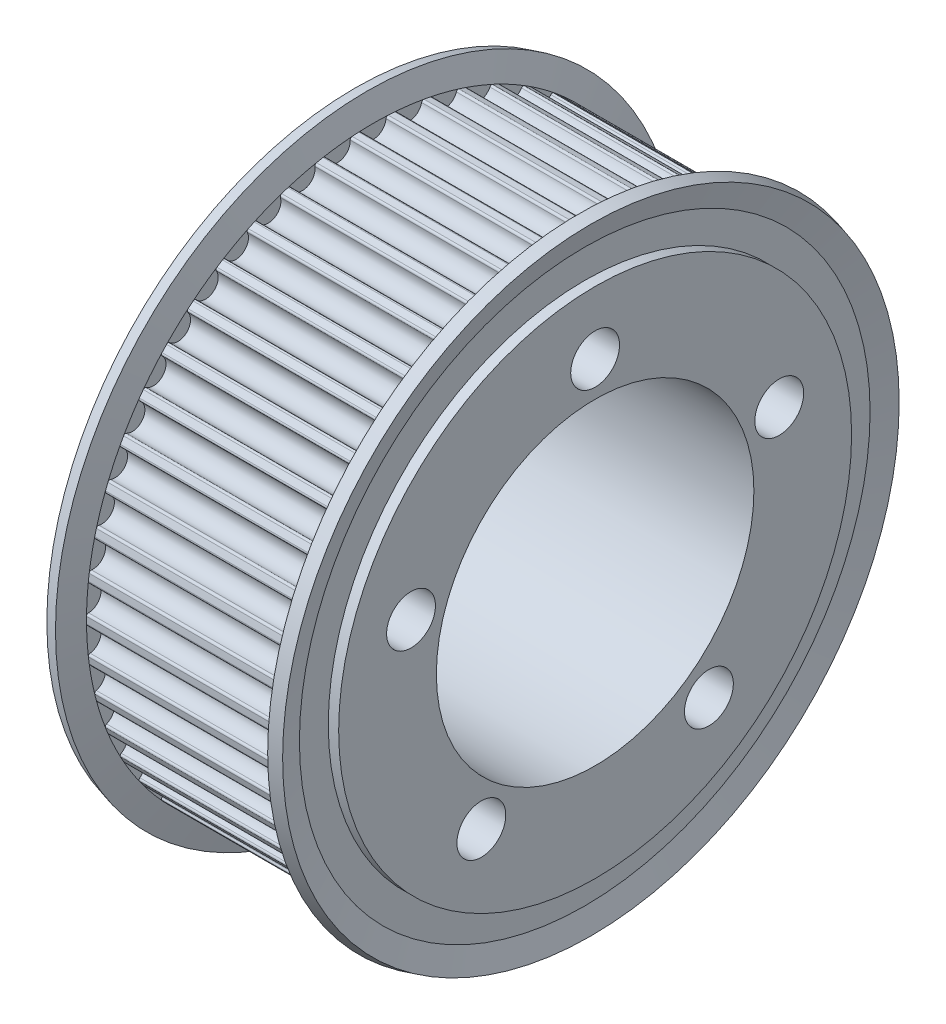
from build123d import *

# Parameters (mm, degrees)
CUT_EXTRUDE1_DEPTH       = 8.15
CUT_EXTRUDE1_DEPTH_BACK  = 8.15
CUT_EXTRUDE2_DEPTH       = 8.15
CUT_EXTRUDE2_DEPTH_BACK  = 8.15
CUT_EXTRUDE3_DEPTH       = 8.15
CUT_EXTRUDE3_DEPTH_BACK  = 8.15
CUT_EXTRUDE4_DEPTH       = 8.15
CUT_EXTRUDE4_DEPTH_BACK  = 8.15
CUT_EXTRUDE5_DEPTH       = 8.15
CUT_EXTRUDE5_DEPTH_BACK  = 8.15
CUT_EXTRUDE6_DEPTH       = 8.15
CUT_EXTRUDE6_DEPTH_BACK  = 8.15
CUT_EXTRUDE7_DEPTH       = 8.15
CUT_EXTRUDE7_DEPTH_BACK  = 8.15
CUT_EXTRUDE8_DEPTH       = 8.15
CUT_EXTRUDE8_DEPTH_BACK  = 8.15
CUT_EXTRUDE9_DEPTH       = 8.15
CUT_EXTRUDE9_DEPTH_BACK  = 8.15
CUT_EXTRUDE10_DEPTH      = 8.15
CUT_EXTRUDE10_DEPTH_BACK = 8.15
CUT_EXTRUDE11_DEPTH      = 8.15
CUT_EXTRUDE11_DEPTH_BACK = 8.15
CUT_EXTRUDE12_DEPTH      = 8.15
CUT_EXTRUDE12_DEPTH_BACK = 8.15
CUT_EXTRUDE13_DEPTH      = 8.15
CUT_EXTRUDE13_DEPTH_BACK = 8.15
CUT_EXTRUDE14_DEPTH      = 8.15
CUT_EXTRUDE14_DEPTH_BACK = 8.15
CUT_EXTRUDE15_DEPTH      = 8.15
CUT_EXTRUDE15_DEPTH_BACK = 8.15
CUT_EXTRUDE16_DEPTH      = 8.15
CUT_EXTRUDE16_DEPTH_BACK = 8.15
CUT_EXTRUDE17_DEPTH      = 8.15
CUT_EXTRUDE17_DEPTH_BACK = 8.15
CUT_EXTRUDE18_DEPTH      = 8.15
CUT_EXTRUDE18_DEPTH_BACK = 8.15
CUT_EXTRUDE19_DEPTH      = 8.15
CUT_EXTRUDE19_DEPTH_BACK = 8.15
CUT_EXTRUDE20_DEPTH      = 8.15
CUT_EXTRUDE20_DEPTH_BACK = 8.15
CUT_EXTRUDE21_DEPTH      = 8.15
CUT_EXTRUDE21_DEPTH_BACK = 8.15
CUT_EXTRUDE22_DEPTH      = 8.15
CUT_EXTRUDE22_DEPTH_BACK = 8.15
CUT_EXTRUDE23_DEPTH      = 8.15
CUT_EXTRUDE23_DEPTH_BACK = 8.15
CUT_EXTRUDE24_DEPTH      = 8.15
CUT_EXTRUDE24_DEPTH_BACK = 8.15
CUT_EXTRUDE25_DEPTH      = 8.15
CUT_EXTRUDE25_DEPTH_BACK = 8.15
CUT_EXTRUDE26_DEPTH      = 8.15
CUT_EXTRUDE26_DEPTH_BACK = 8.15
CUT_EXTRUDE27_DEPTH      = 8.15
CUT_EXTRUDE27_DEPTH_BACK = 8.15
CUT_EXTRUDE28_DEPTH      = 8.15
CUT_EXTRUDE28_DEPTH_BACK = 8.15
CUT_EXTRUDE29_DEPTH      = 8.15
CUT_EXTRUDE29_DEPTH_BACK = 8.15
CUT_EXTRUDE30_DEPTH      = 8.15
CUT_EXTRUDE30_DEPTH_BACK = 8.15
CUT_EXTRUDE31_DEPTH      = 8.15
CUT_EXTRUDE31_DEPTH_BACK = 8.15
CUT_EXTRUDE32_DEPTH      = 8.15
CUT_EXTRUDE32_DEPTH_BACK = 8.15
CUT_EXTRUDE33_DEPTH      = 8.15
CUT_EXTRUDE33_DEPTH_BACK = 8.15
CUT_EXTRUDE34_DEPTH      = 8.15
CUT_EXTRUDE34_DEPTH_BACK = 8.15
CUT_EXTRUDE35_DEPTH      = 8.15
CUT_EXTRUDE35_DEPTH_BACK = 8.15
CUT_EXTRUDE36_DEPTH      = 8.15
CUT_EXTRUDE36_DEPTH_BACK = 8.15
CUT_EXTRUDE37_DEPTH      = 8.15
CUT_EXTRUDE37_DEPTH_BACK = 8.15
CUT_EXTRUDE38_DEPTH      = 8.15
CUT_EXTRUDE38_DEPTH_BACK = 8.15
CUT_EXTRUDE39_DEPTH      = 8.15
CUT_EXTRUDE39_DEPTH_BACK = 8.15
CUT_EXTRUDE40_DEPTH      = 8.15
CUT_EXTRUDE40_DEPTH_BACK = 8.15
CUT_EXTRUDE41_DEPTH      = 8.15
CUT_EXTRUDE41_DEPTH_BACK = 8.15
CUT_EXTRUDE42_DEPTH      = 8.15
CUT_EXTRUDE42_DEPTH_BACK = 8.15
CUT_EXTRUDE43_DEPTH      = 8.15
CUT_EXTRUDE43_DEPTH_BACK = 8.15
CUT_EXTRUDE44_DEPTH      = 8.15
CUT_EXTRUDE44_DEPTH_BACK = 8.15
CUT_EXTRUDE45_DEPTH      = 8.15
CUT_EXTRUDE45_DEPTH_BACK = 8.15
CUT_EXTRUDE46_DEPTH      = 8.15
CUT_EXTRUDE46_DEPTH_BACK = 8.15
CUT_EXTRUDE47_DEPTH      = 8.15
CUT_EXTRUDE47_DEPTH_BACK = 8.15
CUT_EXTRUDE48_DEPTH      = 8.15
CUT_EXTRUDE48_DEPTH_BACK = 8.15
CUT_EXTRUDE49_DEPTH      = 8.15
CUT_EXTRUDE49_DEPTH_BACK = 8.15
CUT_EXTRUDE50_DEPTH      = 8.15
CUT_EXTRUDE50_DEPTH_BACK = 8.15
SKETCH52_W               = 20
SKETCH52_H               = 13
SKETCH53_R               = 2
CUT_EXTRUDE51_DEPTH      = 42.237119201


with BuildPart() as part:
    # Sketch1 → Revolve1 (revolve)
    with BuildSketch(Plane.XY):
        Polygon((0, 0), (0, 21), (0.85, 21), (0.85, 23.363347502), (0.346836043, 25.241180955), (1.312761869, 25.5), (1.85, 23.495), (18.15, 23.495), (18.687238131, 25.5), (19.653163957, 25.241180955), (19.15, 23.363347502), (19.15, 21), (20, 21), (20, 0), align=None)
    revolve(axis=Axis((20, 0, 0), (-1, 0, 0)))

    # Sketch2 → Cut-Extrude1 (cut, two sides: drawn at the far end of the back side and taken through both)
    with BuildSketch(Plane(origin=(10, 0, 0), x_dir=(0, 0, -1), z_dir=(1, 0, 0)).offset(-CUT_EXTRUDE1_DEPTH_BACK)):
        with BuildLine():
            Line((-1.224781335, 23.843563821), (-1.205287433, 23.464064166))
            ThreePointArc((-1.205287433, 23.464064166), (-1.084227929, 23.421881307), (-1.027052897, 23.307138931))
            ThreePointArc((-1.027052897, 23.307138931), (-6.2e-08, 22.355), (1.027052888, 23.307138808))
            ThreePointArc((1.027052888, 23.307138808), (1.084227883, 23.421881266), (1.205287433, 23.464064166))
            Line((1.205287433, 23.464064166), (1.224781335, 23.843563821))
            ThreePointArc((1.224781335, 23.843563821), (0, 23.875), (-1.224781335, 23.843563821))
        make_face()
    extrude(amount=CUT_EXTRUDE1_DEPTH + CUT_EXTRUDE1_DEPTH_BACK, mode=Mode.SUBTRACT)

    # Sketch3 → Cut-Extrude2 (cut, two sides: drawn at the far end of the back side and taken through both)
    with BuildSketch(Plane(origin=(10, 0, 0), x_dir=(0, 0, -1), z_dir=(1, 0, 0)).offset(-CUT_EXTRUDE2_DEPTH_BACK)):
        with BuildLine():
            Line((-4.203514522, 23.502044393), (-4.136610416, 23.127980441))
            ThreePointArc((-4.136610416, 23.127980441), (-4.011218589, 23.101302985), (-3.940113366, 22.994631319))
            ThreePointArc((-3.940113366, 22.994631319), (-2.801824498, 22.17872414), (-1.902204803, 23.252078917))
            ThreePointArc((-1.902204803, 23.252078917), (-1.859861693, 23.373082523), (-1.745043653, 23.430105583))
            Line((-1.745043653, 23.430105583), (-1.773267385, 23.809056004))
            ThreePointArc((-1.773267385, 23.809056004), (-2.992330951, 23.686738494), (-4.203514522, 23.502044393))
        make_face()
    extrude(amount=CUT_EXTRUDE2_DEPTH + CUT_EXTRUDE2_DEPTH_BACK, mode=Mode.SUBTRACT)

    # Sketch4 → Cut-Extrude3 (cut, two sides: drawn at the far end of the back side and taken through both)
    with BuildSketch(Plane(origin=(10, 0, 0), x_dir=(0, 0, -1), z_dir=(1, 0, 0)).offset(-CUT_EXTRUDE3_DEPTH_BACK)):
        with BuildLine():
            Line((-7.115955773, 22.789883686), (-7.002696582, 22.427154647))
            ThreePointArc((-7.002696582, 22.427154647), (-6.874949935, 22.416403315), (-6.791035893, 22.319484634))
            ThreePointArc((-6.791035893, 22.319484634), (-5.559462488, 21.652676552), (-4.801463587, 22.83031985))
            ThreePointArc((-4.801463587, 22.83031985), (-4.774620139, 22.955676306), (-4.667854358, 23.026640239))
            Line((-4.667854358, 23.026640239), (-4.743350619, 23.39906515))
            ThreePointArc((-4.743350619, 23.39906515), (-5.937471056, 23.124922972), (-7.115955773, 22.789883686))
        make_face()
    extrude(amount=CUT_EXTRUDE3_DEPTH + CUT_EXTRUDE3_DEPTH_BACK, mode=Mode.SUBTRACT)

    # Sketch5 → Cut-Extrude4 (cut, two sides: drawn at the far end of the back side and taken through both)
    with BuildSketch(Plane(origin=(10, 0, 0), x_dir=(0, 0, -1), z_dir=(1, 0, 0)).offset(-CUT_EXTRUDE4_DEPTH_BACK)):
        with BuildLine():
            Line((-9.916174152, 21.718312899), (-9.758346039, 21.372639228))
            ThreePointArc((-9.758346039, 21.372639228), (-9.630259213, 21.377983573), (-9.534859727, 21.292346343))
            ThreePointArc((-9.534859727, 21.292346343), (-8.229424433, 20.785153319), (-7.625000423, 22.048513002))
            ThreePointArc((-7.625000423, 22.048513002), (-7.614079973, 22.176245361), (-7.517050211, 22.260031022))
            Line((-7.517050211, 22.260031022), (-7.63862838, 22.620057062))
            ThreePointArc((-7.63862838, 22.620057062), (-8.788973695, 22.198413601), (-9.916174152, 21.718312899))
        make_face()
    extrude(amount=CUT_EXTRUDE4_DEPTH + CUT_EXTRUDE4_DEPTH_BACK, mode=Mode.SUBTRACT)

    # Sketch6 → Cut-Extrude5 (cut, two sides: drawn at the far end of the back side and taken through both)
    with BuildSketch(Plane(origin=(10, 0, 0), x_dir=(0, 0, -1), z_dir=(1, 0, 0)).offset(-CUT_EXTRUDE5_DEPTH_BACK)):
        with BuildLine():
            Line((-12.56000854, 20.304231344), (-12.360100551, 19.981064521))
            ThreePointArc((-12.360100551, 19.981064521), (-12.233693551, 20.00242026), (-12.128313128, 19.929415032))
            ThreePointArc((-12.128313128, 19.929415032), (-10.769603439, 19.589835803), (-10.328286447, 20.918987932))
            ThreePointArc((-10.328286447, 20.918987932), (-10.333461218, 21.047081779), (-10.247697692, 21.142367819))
            Line((-10.247697692, 21.142367819), (-10.413440409, 21.48431716))
            ThreePointArc((-10.413440409, 21.48431716), (-11.501868969, 20.921821986), (-12.56000854, 20.304231344))
        make_face()
    extrude(amount=CUT_EXTRUDE5_DEPTH + CUT_EXTRUDE5_DEPTH_BACK, mode=Mode.SUBTRACT)

    # Sketch7 → Cut-Extrude6 (cut, two sides: drawn at the far end of the back side and taken through both)
    with BuildSketch(Plane(origin=(10, 0, 0), x_dir=(0, 0, -1), z_dir=(1, 0, 0)).offset(-CUT_EXTRUDE6_DEPTH_BACK)):
        with BuildLine():
            Line((-15.00576409, 18.569939932), (-14.766928892, 18.27437649))
            ThreePointArc((-14.766928892, 18.27437649), (-14.644195234, 18.311406831), (-14.530495785, 18.252184939))
            ThreePointArc((-14.530495785, 18.252184939), (-13.139939365, 18.085574873), (-12.868689224, 19.459557927))
            ThreePointArc((-12.868689224, 19.459557927), (-12.889877606, 19.585993144), (-12.816732859, 19.691276846))
            Line((-12.816732859, 19.691276846), (-13.024026262, 20.009756744))
            ThreePointArc((-13.024026262, 20.009756744), (-14.033372898, 19.315280741), (-15.00576409, 18.569939932))
        make_face()
    extrude(amount=CUT_EXTRUDE6_DEPTH + CUT_EXTRUDE6_DEPTH_BACK, mode=Mode.SUBTRACT)

    # Sketch8 → Cut-Extrude7 (cut, two sides: drawn at the far end of the back side and taken through both)
    with BuildSketch(Plane(origin=(10, 0, 0), x_dir=(0, 0, -1), z_dir=(1, 0, 0)).offset(-CUT_EXTRUDE7_DEPTH_BACK)):
        with BuildLine():
            Line((-17.214869777, 16.542789473), (-16.940873944, 16.279490625))
            ThreePointArc((-16.940873944, 16.279490625), (-16.82374921, 16.331611577), (-16.703523844, 16.287106987))
            ThreePointArc((-16.703523844, 16.287106987), (-15.303050598, 16.296093624), (-15.206145084, 17.693239068))
            ThreePointArc((-15.206145084, 17.693239068), (-15.243012925, 17.816021698), (-15.183640493, 17.929642673))
            Line((-15.183640493, 17.929642673), (-15.42921544, 18.21963051))
            ThreePointArc((-15.42921544, 18.21963051), (-16.343562154, 17.40412598), (-17.214869777, 16.542789473))
        make_face()
    extrude(amount=CUT_EXTRUDE7_DEPTH + CUT_EXTRUDE7_DEPTH_BACK, mode=Mode.SUBTRACT)

    # Sketch9 → Cut-Extrude8 (cut, two sides: drawn at the far end of the back side and taken through both)
    with BuildSketch(Plane(origin=(10, 0, 0), x_dir=(0, 0, -1), z_dir=(1, 0, 0)).offset(-CUT_EXTRUDE8_DEPTH_BACK)):
        with BuildLine():
            Line((-19.152486684, 14.254749342), (-18.847651294, 14.027867468))
            ThreePointArc((-18.847651294, 14.027867468), (-18.73798261, 14.094257052), (-18.613127353, 14.065171629))
            ThreePointArc((-18.613127353, 14.065171629), (-17.224823582, 14.249613243), (-17.303790953, 15.64788726))
            ThreePointArc((-17.303790953, 15.64788726), (-17.355756823, 15.765080946), (-17.311093045, 15.885247325))
            Line((-17.311093045, 15.885247325), (-17.591076674, 16.142169819))
            ThreePointArc((-17.591076674, 16.142169819), (-18.396003671, 15.218497755), (-19.152486684, 14.254749342))
        make_face()
    extrude(amount=CUT_EXTRUDE8_DEPTH + CUT_EXTRUDE8_DEPTH_BACK, mode=Mode.SUBTRACT)

    # Sketch10 → Cut-Extrude9 (cut, two sides: drawn at the far end of the back side and taken through both)
    with BuildSketch(Plane(origin=(10, 0, 0), x_dir=(0, 0, -1), z_dir=(1, 0, 0)).offset(-CUT_EXTRUDE9_DEPTH_BACK)):
        with BuildLine():
            Line((-20.788057435, 11.741903299), (-20.457189924, 11.555016461))
            ThreePointArc((-20.457189924, 11.555016461), (-20.356706832, 11.634627675), (-20.229190726, 11.621420112))
            ThreePointArc((-20.229190726, 11.621420112), (-18.874950808, 11.97840795), (-19.128545702, 13.355758922))
            ThreePointArc((-19.128545702, 13.355758922), (-19.194790069, 13.46551545), (-19.165539319, 13.590332138))
            Line((-19.165539319, 13.590332138), (-19.47551612, 13.810137467))
            ThreePointArc((-19.47551612, 13.810137467), (-20.158329221, 12.79286473), (-20.788057435, 11.741903299))
        make_face()
    extrude(amount=CUT_EXTRUDE9_DEPTH + CUT_EXTRUDE9_DEPTH_BACK, mode=Mode.SUBTRACT)

    # Sketch11 → Cut-Extrude10 (cut, two sides: drawn at the far end of the back side and taken through both)
    with BuildSketch(Plane(origin=(10, 0, 0), x_dir=(0, 0, -1), z_dir=(1, 0, 0)).offset(-CUT_EXTRUDE10_DEPTH_BACK)):
        with BuildLine():
            Line((-22.095788102, 9.043880427), (-21.744106448, 8.899935942))
            ThreePointArc((-21.744106448, 8.899935942), (-21.654393626, 8.991513269), (-21.526227676, 8.994391857))
            ThreePointArc((-21.526227676, 8.994391857), (-20.227408784, 9.518296007), (-20.651631858, 10.853002287))
            ThreePointArc((-20.651631858, 10.853002287), (-20.731110009, 10.953590732), (-20.717733589, 11.081089294))
            Line((-20.717733589, 11.081089294), (-21.052815043, 11.260310997))
            ThreePointArc((-21.052815043, 11.260310997), (-21.602745878, 10.165480586), (-22.095788102, 9.043880427))
        make_face()
    extrude(amount=CUT_EXTRUDE10_DEPTH + CUT_EXTRUDE10_DEPTH_BACK, mode=Mode.SUBTRACT)

    # Sketch12 → Cut-Extrude11 (cut, two sides: drawn at the far end of the back side and taken through both)
    with BuildSketch(Plane(origin=(10, 0, 0), x_dir=(0, 0, -1), z_dir=(1, 0, 0)).offset(-CUT_EXTRUDE11_DEPTH_BACK)):
        with BuildLine():
            Line((-23.05505499, 6.203230157), (-22.688105424, 6.104498117))
            ThreePointArc((-22.688105424, 6.104498117), (-22.610577697, 6.206597327), (-22.483783156, 6.225516669))
            ThreePointArc((-22.483783156, 6.225516669), (-21.260868441, 6.90807485), (-21.849029443, 8.179087324))
            ThreePointArc((-21.849029443, 8.179087324), (-21.940487961, 8.268921345), (-21.943196824, 8.397091052))
            Line((-21.943196824, 8.397091052), (-22.298098497, 8.532902697))
            ThreePointArc((-22.298098497, 8.532902697), (-22.706474327, 7.377780741), (-23.05505499, 6.203230157))
        make_face()
    extrude(amount=CUT_EXTRUDE11_DEPTH + CUT_EXTRUDE11_DEPTH_BACK, mode=Mode.SUBTRACT)

    # Sketch13 → Cut-Extrude12 (cut, two sides: drawn at the far end of the back side and taken through both)
    with BuildSketch(Plane(origin=(10, 0, 0), x_dir=(0, 0, -1), z_dir=(1, 0, 0)).offset(-CUT_EXTRUDE12_DEPTH_BACK)):
        with BuildLine():
            Line((-23.65072989, 3.264751243), (-23.274299425, 3.21278871))
            ThreePointArc((-23.274299425, 3.21278871), (-23.210179451, 3.323799637), (-23.086755945, 3.358461365))
            ThreePointArc((-23.086755945, 3.358461365), (-21.959031502, 4.188909227), (-22.701854782, 5.376183267))
            ThreePointArc((-22.701854782, 5.376183267), (-22.80385131, 5.453846128), (-22.822602737, 5.580665668))
            Line((-22.822602737, 5.580665668), (-23.191727617, 5.670925423))
            ThreePointArc((-23.191727617, 5.670925423), (-23.452108111, 4.473728886), (-23.65072989, 3.264751243))
        make_face()
    extrude(amount=CUT_EXTRUDE12_DEPTH + CUT_EXTRUDE12_DEPTH_BACK, mode=Mode.SUBTRACT)

    # Sketch14 → Cut-Extrude13 (cut, two sides: drawn at the far end of the back side and taken through both)
    with BuildSketch(Plane(origin=(10, 0, 0), x_dir=(0, 0, -1), z_dir=(1, 0, 0)).offset(-CUT_EXTRUDE13_DEPTH_BACK)):
        with BuildLine():
            Line((-23.873418651, 0.274785251), (-23.49344382, 0.270411706))
            ThreePointArc((-23.49344382, 0.270411706), (-23.44374281, 0.388583642), (-23.325636802, 0.438441119))
            ThreePointArc((-23.325636802, 0.438441119), (-22.310887518, 1.403682002), (-23.196658309, 2.488493588))
            ThreePointArc((-23.196658309, 2.488493588), (-23.307584302, 2.5527605), (-23.342082571, 2.676229853))
            Line((-23.342082571, 2.676229853), (-23.719609338, 2.719514269))
            ThreePointArc((-23.719609338, 2.719514269), (-23.827888141, 1.499123654), (-23.873418651, 0.274785251))
        make_face()
    extrude(amount=CUT_EXTRUDE13_DEPTH + CUT_EXTRUDE13_DEPTH_BACK, mode=Mode.SUBTRACT)

    # Sketch15 → Cut-Extrude14 (cut, two sides: drawn at the far end of the back side and taken through both)
    with BuildSketch(Plane(origin=(10, 0, 0), x_dir=(0, 0, -1), z_dir=(1, 0, 0)).offset(-CUT_EXTRUDE14_DEPTH_BACK)):
        with BuildLine():
            Line((-23.719609338, -2.719514269), (-23.342082571, -2.676229853))
            ThreePointArc((-23.342082571, -2.676229853), (-23.30758434, -2.552760549), (-23.196658432, -2.488493605))
            ThreePointArc((-23.196658432, -2.488493605), (-22.31088751, -1.403682126), (-23.325636678, -0.438441121))
            ThreePointArc((-23.325636678, -0.438441121), (-23.443742766, -0.388583686), (-23.49344382, -0.270411706))
            Line((-23.49344382, -0.270411706), (-23.873418651, -0.274785251))
            ThreePointArc((-23.873418651, -0.274785251), (-23.827888141, -1.499123654), (-23.719609338, -2.719514269))
        make_face()
    extrude(amount=CUT_EXTRUDE14_DEPTH + CUT_EXTRUDE14_DEPTH_BACK, mode=Mode.SUBTRACT)

    # Sketch16 → Cut-Extrude15 (cut, two sides: drawn at the far end of the back side and taken through both)
    with BuildSketch(Plane(origin=(10, 0, 0), x_dir=(0, 0, -1), z_dir=(1, 0, 0)).offset(-CUT_EXTRUDE15_DEPTH_BACK)):
        with BuildLine():
            Line((-23.191727617, -5.670925423), (-22.822602737, -5.580665668))
            ThreePointArc((-22.822602737, -5.580665668), (-22.803851341, -5.453846181), (-22.701854901, -5.376183299))
            ThreePointArc((-22.701854901, -5.376183299), (-21.959031478, -4.188909348), (-23.086755822, -3.358461351))
            ThreePointArc((-23.086755822, -3.358461351), (-23.210179402, -3.323799675), (-23.274299425, -3.21278871))
            Line((-23.274299425, -3.21278871), (-23.65072989, -3.264751243))
            ThreePointArc((-23.65072989, -3.264751243), (-23.452108111, -4.473728886), (-23.191727617, -5.670925423))
        make_face()
    extrude(amount=CUT_EXTRUDE15_DEPTH + CUT_EXTRUDE15_DEPTH_BACK, mode=Mode.SUBTRACT)

    # Sketch17 → Cut-Extrude16 (cut, two sides: drawn at the far end of the back side and taken through both)
    with BuildSketch(Plane(origin=(10, 0, 0), x_dir=(0, 0, -1), z_dir=(1, 0, 0)).offset(-CUT_EXTRUDE16_DEPTH_BACK)):
        with BuildLine():
            Line((-22.298098497, -8.532902697), (-21.943196824, -8.397091052))
            ThreePointArc((-21.943196824, -8.397091052), (-21.940487985, -8.268921402), (-21.849029558, -8.179087371))
            ThreePointArc((-21.849029558, -8.179087371), (-21.260868403, -6.908074968), (-22.483783036, -6.22551664))
            ThreePointArc((-22.483783036, -6.22551664), (-22.610577644, -6.206597358), (-22.688105424, -6.104498117))
            Line((-22.688105424, -6.104498117), (-23.05505499, -6.203230157))
            ThreePointArc((-23.05505499, -6.203230157), (-22.706474327, -7.377780741), (-22.298098497, -8.532902697))
        make_face()
    extrude(amount=CUT_EXTRUDE16_DEPTH + CUT_EXTRUDE16_DEPTH_BACK, mode=Mode.SUBTRACT)

    # Sketch18 → Cut-Extrude17 (cut, two sides: drawn at the far end of the back side and taken through both)
    with BuildSketch(Plane(origin=(10, 0, 0), x_dir=(0, 0, -1), z_dir=(1, 0, 0)).offset(-CUT_EXTRUDE17_DEPTH_BACK)):
        with BuildLine():
            Line((-21.052815043, -11.260310997), (-20.717733589, -11.081089294))
            ThreePointArc((-20.717733589, -11.081089294), (-20.731110027, -10.953590792), (-20.651631966, -10.853002348))
            ThreePointArc((-20.651631966, -10.853002348), (-20.227408732, -9.518296119), (-21.52622756, -8.994391813))
            ThreePointArc((-21.52622756, -8.994391813), (-21.654393569, -8.991513293), (-21.744106448, -8.899935942))
            Line((-21.744106448, -8.899935942), (-22.095788102, -9.043880427))
            ThreePointArc((-22.095788102, -9.043880427), (-21.602745878, -10.165480586), (-21.052815043, -11.260310997))
        make_face()
    extrude(amount=CUT_EXTRUDE17_DEPTH + CUT_EXTRUDE17_DEPTH_BACK, mode=Mode.SUBTRACT)

    # Sketch19 → Cut-Extrude18 (cut, two sides: drawn at the far end of the back side and taken through both)
    with BuildSketch(Plane(origin=(10, 0, 0), x_dir=(0, 0, -1), z_dir=(1, 0, 0)).offset(-CUT_EXTRUDE18_DEPTH_BACK)):
        with BuildLine():
            Line((-19.47551612, -13.810137467), (-19.165539319, -13.590332138))
            ThreePointArc((-19.165539319, -13.590332138), (-19.194790079, -13.465515512), (-19.128545801, -13.355758996))
            ThreePointArc((-19.128545801, -13.355758996), (-18.874950741, -11.978408054), (-20.229190616, -11.621420053))
            ThreePointArc((-20.229190616, -11.621420053), (-20.356706772, -11.634627692), (-20.457189924, -11.555016461))
            Line((-20.457189924, -11.555016461), (-20.788057435, -11.741903299))
            ThreePointArc((-20.788057435, -11.741903299), (-20.158329221, -12.79286473), (-19.47551612, -13.810137467))
        make_face()
    extrude(amount=CUT_EXTRUDE18_DEPTH + CUT_EXTRUDE18_DEPTH_BACK, mode=Mode.SUBTRACT)

    # Sketch20 → Cut-Extrude19 (cut, two sides: drawn at the far end of the back side and taken through both)
    with BuildSketch(Plane(origin=(10, 0, 0), x_dir=(0, 0, -1), z_dir=(1, 0, 0)).offset(-CUT_EXTRUDE19_DEPTH_BACK)):
        with BuildLine():
            Line((-17.591076674, -16.142169819), (-17.311093045, -15.885247325))
            ThreePointArc((-17.311093045, -15.885247325), (-17.355756825, -15.765081008), (-17.303791042, -15.647887346))
            ThreePointArc((-17.303791042, -15.647887346), (-17.224823503, -14.249613339), (-18.613127252, -14.065171557))
            ThreePointArc((-18.613127252, -14.065171557), (-18.737982549, -14.094257062), (-18.847651294, -14.027867468))
            Line((-18.847651294, -14.027867468), (-19.152486684, -14.254749342))
            ThreePointArc((-19.152486684, -14.254749342), (-18.396003671, -15.218497755), (-17.591076674, -16.142169819))
        make_face()
    extrude(amount=CUT_EXTRUDE19_DEPTH + CUT_EXTRUDE19_DEPTH_BACK, mode=Mode.SUBTRACT)

    # Sketch21 → Cut-Extrude20 (cut, two sides: drawn at the far end of the back side and taken through both)
    with BuildSketch(Plane(origin=(10, 0, 0), x_dir=(0, 0, -1), z_dir=(1, 0, 0)).offset(-CUT_EXTRUDE20_DEPTH_BACK)):
        with BuildLine():
            Line((-15.42921544, -18.21963051), (-15.183640493, -17.929642673))
            ThreePointArc((-15.183640493, -17.929642673), (-15.243012919, -17.816021759), (-15.206145162, -17.693239164))
            ThreePointArc((-15.206145162, -17.693239164), (-15.303050508, -16.296093708), (-16.703523753, -16.287106904))
            ThreePointArc((-16.703523753, -16.287106904), (-16.823749148, -16.331611579), (-16.940873944, -16.279490625))
            Line((-16.940873944, -16.279490625), (-17.214869777, -16.542789473))
            ThreePointArc((-17.214869777, -16.542789473), (-16.343562154, -17.40412598), (-15.42921544, -18.21963051))
        make_face()
    extrude(amount=CUT_EXTRUDE20_DEPTH + CUT_EXTRUDE20_DEPTH_BACK, mode=Mode.SUBTRACT)

    # Sketch22 → Cut-Extrude21 (cut, two sides: drawn at the far end of the back side and taken through both)
    with BuildSketch(Plane(origin=(10, 0, 0), x_dir=(0, 0, -1), z_dir=(1, 0, 0)).offset(-CUT_EXTRUDE21_DEPTH_BACK)):
        with BuildLine():
            Line((-13.024026262, -20.009756744), (-12.816732859, -19.691276846))
            ThreePointArc((-12.816732859, -19.691276846), (-12.889877593, -19.585993205), (-12.868689289, -19.459558032))
            ThreePointArc((-12.868689289, -19.459558032), (-13.139939265, -18.085574946), (-14.530495705, -18.252184845))
            ThreePointArc((-14.530495705, -18.252184845), (-14.644195172, -18.311406825), (-14.766928892, -18.27437649))
            Line((-14.766928892, -18.27437649), (-15.00576409, -18.569939932))
            ThreePointArc((-15.00576409, -18.569939932), (-14.033372898, -19.315280741), (-13.024026262, -20.009756744))
        make_face()
    extrude(amount=CUT_EXTRUDE21_DEPTH + CUT_EXTRUDE21_DEPTH_BACK, mode=Mode.SUBTRACT)

    # Sketch23 → Cut-Extrude22 (cut, two sides: drawn at the far end of the back side and taken through both)
    with BuildSketch(Plane(origin=(10, 0, 0), x_dir=(0, 0, -1), z_dir=(1, 0, 0)).offset(-CUT_EXTRUDE22_DEPTH_BACK)):
        with BuildLine():
            Line((-10.413440409, -21.48431716), (-10.247697692, -21.142367819))
            ThreePointArc((-10.247697692, -21.142367819), (-10.333461197, -21.047081837), (-10.328286498, -20.918988045))
            ThreePointArc((-10.328286498, -20.918988045), (-10.76960333, -19.589835862), (-12.12831306, -19.929414928))
            ThreePointArc((-12.12831306, -19.929414928), (-12.233693491, -20.002420247), (-12.360100551, -19.981064521))
            Line((-12.360100551, -19.981064521), (-12.56000854, -20.304231344))
            ThreePointArc((-12.56000854, -20.304231344), (-11.501868969, -20.921821986), (-10.413440409, -21.48431716))
        make_face()
    extrude(amount=CUT_EXTRUDE22_DEPTH + CUT_EXTRUDE22_DEPTH_BACK, mode=Mode.SUBTRACT)

    # Sketch24 → Cut-Extrude23 (cut, two sides: drawn at the far end of the back side and taken through both)
    with BuildSketch(Plane(origin=(10, 0, 0), x_dir=(0, 0, -1), z_dir=(1, 0, 0)).offset(-CUT_EXTRUDE23_DEPTH_BACK)):
        with BuildLine():
            Line((-7.63862838, -22.620057062), (-7.517050211, -22.260031022))
            ThreePointArc((-7.517050211, -22.260031022), (-7.614079945, -22.176245416), (-7.62500046, -22.04851312))
            ThreePointArc((-7.62500046, -22.04851312), (-8.229424318, -20.785153365), (-9.534859673, -21.292346232))
            ThreePointArc((-9.534859673, -21.292346232), (-9.630259155, -21.377983552), (-9.758346039, -21.372639228))
            Line((-9.758346039, -21.372639228), (-9.916174152, -21.718312899))
            ThreePointArc((-9.916174152, -21.718312899), (-8.788973695, -22.198413601), (-7.63862838, -22.620057062))
        make_face()
    extrude(amount=CUT_EXTRUDE23_DEPTH + CUT_EXTRUDE23_DEPTH_BACK, mode=Mode.SUBTRACT)

    # Sketch25 → Cut-Extrude24 (cut, two sides: drawn at the far end of the back side and taken through both)
    with BuildSketch(Plane(origin=(10, 0, 0), x_dir=(0, 0, -1), z_dir=(1, 0, 0)).offset(-CUT_EXTRUDE24_DEPTH_BACK)):
        with BuildLine():
            Line((-4.743350619, -23.39906515), (-4.667854358, -23.026640239))
            ThreePointArc((-4.667854358, -23.026640239), (-4.774620104, -22.955676357), (-4.801463609, -22.830319972))
            ThreePointArc((-4.801463609, -22.830319972), (-5.559462368, -21.652676582), (-6.791035853, -22.319484517))
            ThreePointArc((-6.791035853, -22.319484517), (-6.87494988, -22.416403287), (-7.002696582, -22.427154647))
            Line((-7.002696582, -22.427154647), (-7.115955773, -22.789883686))
            ThreePointArc((-7.115955773, -22.789883686), (-5.937471056, -23.124922972), (-4.743350619, -23.39906515))
        make_face()
    extrude(amount=CUT_EXTRUDE24_DEPTH + CUT_EXTRUDE24_DEPTH_BACK, mode=Mode.SUBTRACT)

    # Sketch26 → Cut-Extrude25 (cut, two sides: drawn at the far end of the back side and taken through both)
    with BuildSketch(Plane(origin=(10, 0, 0), x_dir=(0, 0, -1), z_dir=(1, 0, 0)).offset(-CUT_EXTRUDE25_DEPTH_BACK)):
        with BuildLine():
            Line((-1.773267385, -23.809056004), (-1.745043653, -23.430105583))
            ThreePointArc((-1.745043653, -23.430105583), (-1.859861652, -23.37308257), (-1.902204809, -23.25207904))
            ThreePointArc((-1.902204809, -23.25207904), (-2.801824375, -22.178724156), (-3.940113341, -22.994631198))
            ThreePointArc((-3.940113341, -22.994631198), (-4.011218538, -23.10130295), (-4.136610416, -23.127980441))
            Line((-4.136610416, -23.127980441), (-4.203514522, -23.502044393))
            ThreePointArc((-4.203514522, -23.502044393), (-2.992330951, -23.686738494), (-1.773267385, -23.809056004))
        make_face()
    extrude(amount=CUT_EXTRUDE25_DEPTH + CUT_EXTRUDE25_DEPTH_BACK, mode=Mode.SUBTRACT)

    # Sketch27 → Cut-Extrude26 (cut, two sides: drawn at the far end of the back side and taken through both)
    with BuildSketch(Plane(origin=(10, 0, 0), x_dir=(0, 0, -1), z_dir=(1, 0, 0)).offset(-CUT_EXTRUDE26_DEPTH_BACK)):
        with BuildLine():
            Line((1.224781335, -23.843563821), (1.205287433, -23.464064166))
            ThreePointArc((1.205287433, -23.464064166), (1.084227929, -23.421881307), (1.027052897, -23.307138931))
            ThreePointArc((1.027052897, -23.307138931), (6.2e-08, -22.355), (-1.027052888, -23.307138808))
            ThreePointArc((-1.027052888, -23.307138808), (-1.084227883, -23.421881266), (-1.205287433, -23.464064166))
            Line((-1.205287433, -23.464064166), (-1.224781335, -23.843563821))
            ThreePointArc((-1.224781335, -23.843563821), (0, -23.875), (1.224781335, -23.843563821))
        make_face()
    extrude(amount=CUT_EXTRUDE26_DEPTH + CUT_EXTRUDE26_DEPTH_BACK, mode=Mode.SUBTRACT)

    # Sketch28 → Cut-Extrude27 (cut, two sides: drawn at the far end of the back side and taken through both)
    with BuildSketch(Plane(origin=(10, 0, 0), x_dir=(0, 0, -1), z_dir=(1, 0, 0)).offset(-CUT_EXTRUDE27_DEPTH_BACK)):
        with BuildLine():
            Line((4.203514522, -23.502044393), (4.136610416, -23.127980441))
            ThreePointArc((4.136610416, -23.127980441), (4.011218589, -23.101302985), (3.940113366, -22.994631319))
            ThreePointArc((3.940113366, -22.994631319), (2.801824498, -22.17872414), (1.902204803, -23.252078917))
            ThreePointArc((1.902204803, -23.252078917), (1.859861693, -23.373082523), (1.745043653, -23.430105583))
            Line((1.745043653, -23.430105583), (1.773267385, -23.809056004))
            ThreePointArc((1.773267385, -23.809056004), (2.992330951, -23.686738494), (4.203514522, -23.502044393))
        make_face()
    extrude(amount=CUT_EXTRUDE27_DEPTH + CUT_EXTRUDE27_DEPTH_BACK, mode=Mode.SUBTRACT)

    # Sketch29 → Cut-Extrude28 (cut, two sides: drawn at the far end of the back side and taken through both)
    with BuildSketch(Plane(origin=(10, 0, 0), x_dir=(0, 0, -1), z_dir=(1, 0, 0)).offset(-CUT_EXTRUDE28_DEPTH_BACK)):
        with BuildLine():
            Line((7.115955773, -22.789883686), (7.002696582, -22.427154647))
            ThreePointArc((7.002696582, -22.427154647), (6.874949935, -22.416403315), (6.791035893, -22.319484634))
            ThreePointArc((6.791035893, -22.319484634), (5.559462488, -21.652676552), (4.801463587, -22.83031985))
            ThreePointArc((4.801463587, -22.83031985), (4.774620139, -22.955676306), (4.667854358, -23.026640239))
            Line((4.667854358, -23.026640239), (4.743350619, -23.39906515))
            ThreePointArc((4.743350619, -23.39906515), (5.937471056, -23.124922972), (7.115955773, -22.789883686))
        make_face()
    extrude(amount=CUT_EXTRUDE28_DEPTH + CUT_EXTRUDE28_DEPTH_BACK, mode=Mode.SUBTRACT)

    # Sketch30 → Cut-Extrude29 (cut, two sides: drawn at the far end of the back side and taken through both)
    with BuildSketch(Plane(origin=(10, 0, 0), x_dir=(0, 0, -1), z_dir=(1, 0, 0)).offset(-CUT_EXTRUDE29_DEPTH_BACK)):
        with BuildLine():
            Line((9.916174152, -21.718312899), (9.758346039, -21.372639228))
            ThreePointArc((9.758346039, -21.372639228), (9.630259213, -21.377983573), (9.534859727, -21.292346343))
            ThreePointArc((9.534859727, -21.292346343), (8.229424433, -20.785153319), (7.625000423, -22.048513002))
            ThreePointArc((7.625000423, -22.048513002), (7.614079973, -22.176245361), (7.517050211, -22.260031022))
            Line((7.517050211, -22.260031022), (7.63862838, -22.620057062))
            ThreePointArc((7.63862838, -22.620057062), (8.788973695, -22.198413601), (9.916174152, -21.718312899))
        make_face()
    extrude(amount=CUT_EXTRUDE29_DEPTH + CUT_EXTRUDE29_DEPTH_BACK, mode=Mode.SUBTRACT)

    # Sketch31 → Cut-Extrude30 (cut, two sides: drawn at the far end of the back side and taken through both)
    with BuildSketch(Plane(origin=(10, 0, 0), x_dir=(0, 0, -1), z_dir=(1, 0, 0)).offset(-CUT_EXTRUDE30_DEPTH_BACK)):
        with BuildLine():
            Line((12.56000854, -20.304231344), (12.360100551, -19.981064521))
            ThreePointArc((12.360100551, -19.981064521), (12.233693551, -20.00242026), (12.128313128, -19.929415032))
            ThreePointArc((12.128313128, -19.929415032), (10.769603439, -19.589835803), (10.328286447, -20.918987932))
            ThreePointArc((10.328286447, -20.918987932), (10.333461218, -21.047081779), (10.247697692, -21.142367819))
            Line((10.247697692, -21.142367819), (10.413440409, -21.48431716))
            ThreePointArc((10.413440409, -21.48431716), (11.501868969, -20.921821986), (12.56000854, -20.304231344))
        make_face()
    extrude(amount=CUT_EXTRUDE30_DEPTH + CUT_EXTRUDE30_DEPTH_BACK, mode=Mode.SUBTRACT)

    # Sketch32 → Cut-Extrude31 (cut, two sides: drawn at the far end of the back side and taken through both)
    with BuildSketch(Plane(origin=(10, 0, 0), x_dir=(0, 0, -1), z_dir=(1, 0, 0)).offset(-CUT_EXTRUDE31_DEPTH_BACK)):
        with BuildLine():
            Line((15.00576409, -18.569939932), (14.766928892, -18.27437649))
            ThreePointArc((14.766928892, -18.27437649), (14.644195234, -18.311406831), (14.530495785, -18.252184939))
            ThreePointArc((14.530495785, -18.252184939), (13.139939365, -18.085574873), (12.868689224, -19.459557927))
            ThreePointArc((12.868689224, -19.459557927), (12.889877606, -19.585993144), (12.816732859, -19.691276846))
            Line((12.816732859, -19.691276846), (13.024026262, -20.009756744))
            ThreePointArc((13.024026262, -20.009756744), (14.033372898, -19.315280741), (15.00576409, -18.569939932))
        make_face()
    extrude(amount=CUT_EXTRUDE31_DEPTH + CUT_EXTRUDE31_DEPTH_BACK, mode=Mode.SUBTRACT)

    # Sketch33 → Cut-Extrude32 (cut, two sides: drawn at the far end of the back side and taken through both)
    with BuildSketch(Plane(origin=(10, 0, 0), x_dir=(0, 0, -1), z_dir=(1, 0, 0)).offset(-CUT_EXTRUDE32_DEPTH_BACK)):
        with BuildLine():
            Line((17.214869777, -16.542789473), (16.940873944, -16.279490625))
            ThreePointArc((16.940873944, -16.279490625), (16.82374921, -16.331611577), (16.703523844, -16.287106987))
            ThreePointArc((16.703523844, -16.287106987), (15.303050598, -16.296093624), (15.206145084, -17.693239068))
            ThreePointArc((15.206145084, -17.693239068), (15.243012925, -17.816021698), (15.183640493, -17.929642673))
            Line((15.183640493, -17.929642673), (15.42921544, -18.21963051))
            ThreePointArc((15.42921544, -18.21963051), (16.343562154, -17.40412598), (17.214869777, -16.542789473))
        make_face()
    extrude(amount=CUT_EXTRUDE32_DEPTH + CUT_EXTRUDE32_DEPTH_BACK, mode=Mode.SUBTRACT)

    # Sketch34 → Cut-Extrude33 (cut, two sides: drawn at the far end of the back side and taken through both)
    with BuildSketch(Plane(origin=(10, 0, 0), x_dir=(0, 0, -1), z_dir=(1, 0, 0)).offset(-CUT_EXTRUDE33_DEPTH_BACK)):
        with BuildLine():
            Line((19.152486684, -14.254749342), (18.847651294, -14.027867468))
            ThreePointArc((18.847651294, -14.027867468), (18.73798261, -14.094257052), (18.613127353, -14.065171629))
            ThreePointArc((18.613127353, -14.065171629), (17.224823582, -14.249613243), (17.303790953, -15.64788726))
            ThreePointArc((17.303790953, -15.64788726), (17.355756823, -15.765080946), (17.311093045, -15.885247325))
            Line((17.311093045, -15.885247325), (17.591076674, -16.142169819))
            ThreePointArc((17.591076674, -16.142169819), (18.396003671, -15.218497755), (19.152486684, -14.254749342))
        make_face()
    extrude(amount=CUT_EXTRUDE33_DEPTH + CUT_EXTRUDE33_DEPTH_BACK, mode=Mode.SUBTRACT)

    # Sketch35 → Cut-Extrude34 (cut, two sides: drawn at the far end of the back side and taken through both)
    with BuildSketch(Plane(origin=(10, 0, 0), x_dir=(0, 0, -1), z_dir=(1, 0, 0)).offset(-CUT_EXTRUDE34_DEPTH_BACK)):
        with BuildLine():
            Line((20.788057435, -11.741903299), (20.457189924, -11.555016461))
            ThreePointArc((20.457189924, -11.555016461), (20.356706832, -11.634627675), (20.229190726, -11.621420112))
            ThreePointArc((20.229190726, -11.621420112), (18.874950808, -11.97840795), (19.128545702, -13.355758922))
            ThreePointArc((19.128545702, -13.355758922), (19.194790069, -13.46551545), (19.165539319, -13.590332138))
            Line((19.165539319, -13.590332138), (19.47551612, -13.810137467))
            ThreePointArc((19.47551612, -13.810137467), (20.158329221, -12.79286473), (20.788057435, -11.741903299))
        make_face()
    extrude(amount=CUT_EXTRUDE34_DEPTH + CUT_EXTRUDE34_DEPTH_BACK, mode=Mode.SUBTRACT)

    # Sketch36 → Cut-Extrude35 (cut, two sides: drawn at the far end of the back side and taken through both)
    with BuildSketch(Plane(origin=(10, 0, 0), x_dir=(0, 0, -1), z_dir=(1, 0, 0)).offset(-CUT_EXTRUDE35_DEPTH_BACK)):
        with BuildLine():
            Line((22.095788102, -9.043880427), (21.744106448, -8.899935942))
            ThreePointArc((21.744106448, -8.899935942), (21.654393626, -8.991513269), (21.526227676, -8.994391857))
            ThreePointArc((21.526227676, -8.994391857), (20.227408784, -9.518296007), (20.651631858, -10.853002287))
            ThreePointArc((20.651631858, -10.853002287), (20.731110009, -10.953590732), (20.717733589, -11.081089294))
            Line((20.717733589, -11.081089294), (21.052815043, -11.260310997))
            ThreePointArc((21.052815043, -11.260310997), (21.602745878, -10.165480586), (22.095788102, -9.043880427))
        make_face()
    extrude(amount=CUT_EXTRUDE35_DEPTH + CUT_EXTRUDE35_DEPTH_BACK, mode=Mode.SUBTRACT)

    # Sketch37 → Cut-Extrude36 (cut, two sides: drawn at the far end of the back side and taken through both)
    with BuildSketch(Plane(origin=(10, 0, 0), x_dir=(0, 0, -1), z_dir=(1, 0, 0)).offset(-CUT_EXTRUDE36_DEPTH_BACK)):
        with BuildLine():
            Line((23.05505499, -6.203230157), (22.688105424, -6.104498117))
            ThreePointArc((22.688105424, -6.104498117), (22.610577697, -6.206597327), (22.483783156, -6.225516669))
            ThreePointArc((22.483783156, -6.225516669), (21.260868441, -6.90807485), (21.849029443, -8.179087324))
            ThreePointArc((21.849029443, -8.179087324), (21.940487961, -8.268921345), (21.943196824, -8.397091052))
            Line((21.943196824, -8.397091052), (22.298098497, -8.532902697))
            ThreePointArc((22.298098497, -8.532902697), (22.706474327, -7.377780741), (23.05505499, -6.203230157))
        make_face()
    extrude(amount=CUT_EXTRUDE36_DEPTH + CUT_EXTRUDE36_DEPTH_BACK, mode=Mode.SUBTRACT)

    # Sketch38 → Cut-Extrude37 (cut, two sides: drawn at the far end of the back side and taken through both)
    with BuildSketch(Plane(origin=(10, 0, 0), x_dir=(0, 0, -1), z_dir=(1, 0, 0)).offset(-CUT_EXTRUDE37_DEPTH_BACK)):
        with BuildLine():
            Line((23.65072989, -3.264751243), (23.274299425, -3.21278871))
            ThreePointArc((23.274299425, -3.21278871), (23.210179451, -3.323799637), (23.086755945, -3.358461365))
            ThreePointArc((23.086755945, -3.358461365), (21.959031502, -4.188909227), (22.701854782, -5.376183267))
            ThreePointArc((22.701854782, -5.376183267), (22.80385131, -5.453846128), (22.822602737, -5.580665668))
            Line((22.822602737, -5.580665668), (23.191727617, -5.670925423))
            ThreePointArc((23.191727617, -5.670925423), (23.452108111, -4.473728886), (23.65072989, -3.264751243))
        make_face()
    extrude(amount=CUT_EXTRUDE37_DEPTH + CUT_EXTRUDE37_DEPTH_BACK, mode=Mode.SUBTRACT)

    # Sketch39 → Cut-Extrude38 (cut, two sides: drawn at the far end of the back side and taken through both)
    with BuildSketch(Plane(origin=(10, 0, 0), x_dir=(0, 0, -1), z_dir=(1, 0, 0)).offset(-CUT_EXTRUDE38_DEPTH_BACK)):
        with BuildLine():
            Line((23.873418651, -0.274785251), (23.49344382, -0.270411706))
            ThreePointArc((23.49344382, -0.270411706), (23.44374281, -0.388583642), (23.325636802, -0.438441119))
            ThreePointArc((23.325636802, -0.438441119), (22.310887518, -1.403682002), (23.196658309, -2.488493588))
            ThreePointArc((23.196658309, -2.488493588), (23.307584302, -2.5527605), (23.342082571, -2.676229853))
            Line((23.342082571, -2.676229853), (23.719609338, -2.719514269))
            ThreePointArc((23.719609338, -2.719514269), (23.827888141, -1.499123654), (23.873418651, -0.274785251))
        make_face()
    extrude(amount=CUT_EXTRUDE38_DEPTH + CUT_EXTRUDE38_DEPTH_BACK, mode=Mode.SUBTRACT)

    # Sketch40 → Cut-Extrude39 (cut, two sides: drawn at the far end of the back side and taken through both)
    with BuildSketch(Plane(origin=(10, 0, 0), x_dir=(0, 0, -1), z_dir=(1, 0, 0)).offset(-CUT_EXTRUDE39_DEPTH_BACK)):
        with BuildLine():
            Line((23.719609338, 2.719514269), (23.342082571, 2.676229853))
            ThreePointArc((23.342082571, 2.676229853), (23.30758434, 2.552760549), (23.196658432, 2.488493605))
            ThreePointArc((23.196658432, 2.488493605), (22.31088751, 1.403682126), (23.325636678, 0.438441121))
            ThreePointArc((23.325636678, 0.438441121), (23.443742766, 0.388583686), (23.49344382, 0.270411706))
            Line((23.49344382, 0.270411706), (23.873418651, 0.274785251))
            ThreePointArc((23.873418651, 0.274785251), (23.827888141, 1.499123654), (23.719609338, 2.719514269))
        make_face()
    extrude(amount=CUT_EXTRUDE39_DEPTH + CUT_EXTRUDE39_DEPTH_BACK, mode=Mode.SUBTRACT)

    # Sketch41 → Cut-Extrude40 (cut, two sides: drawn at the far end of the back side and taken through both)
    with BuildSketch(Plane(origin=(10, 0, 0), x_dir=(0, 0, -1), z_dir=(1, 0, 0)).offset(-CUT_EXTRUDE40_DEPTH_BACK)):
        with BuildLine():
            Line((23.191727617, 5.670925423), (22.822602737, 5.580665668))
            ThreePointArc((22.822602737, 5.580665668), (22.803851341, 5.453846181), (22.701854901, 5.376183299))
            ThreePointArc((22.701854901, 5.376183299), (21.959031478, 4.188909348), (23.086755822, 3.358461351))
            ThreePointArc((23.086755822, 3.358461351), (23.210179402, 3.323799675), (23.274299425, 3.21278871))
            Line((23.274299425, 3.21278871), (23.65072989, 3.264751243))
            ThreePointArc((23.65072989, 3.264751243), (23.452108111, 4.473728886), (23.191727617, 5.670925423))
        make_face()
    extrude(amount=CUT_EXTRUDE40_DEPTH + CUT_EXTRUDE40_DEPTH_BACK, mode=Mode.SUBTRACT)

    # Sketch42 → Cut-Extrude41 (cut, two sides: drawn at the far end of the back side and taken through both)
    with BuildSketch(Plane(origin=(10, 0, 0), x_dir=(0, 0, -1), z_dir=(1, 0, 0)).offset(-CUT_EXTRUDE41_DEPTH_BACK)):
        with BuildLine():
            Line((22.298098497, 8.532902697), (21.943196824, 8.397091052))
            ThreePointArc((21.943196824, 8.397091052), (21.940487985, 8.268921402), (21.849029558, 8.179087371))
            ThreePointArc((21.849029558, 8.179087371), (21.260868403, 6.908074968), (22.483783036, 6.22551664))
            ThreePointArc((22.483783036, 6.22551664), (22.610577644, 6.206597358), (22.688105424, 6.104498117))
            Line((22.688105424, 6.104498117), (23.05505499, 6.203230157))
            ThreePointArc((23.05505499, 6.203230157), (22.706474327, 7.377780741), (22.298098497, 8.532902697))
        make_face()
    extrude(amount=CUT_EXTRUDE41_DEPTH + CUT_EXTRUDE41_DEPTH_BACK, mode=Mode.SUBTRACT)

    # Sketch43 → Cut-Extrude42 (cut, two sides: drawn at the far end of the back side and taken through both)
    with BuildSketch(Plane(origin=(10, 0, 0), x_dir=(0, 0, -1), z_dir=(1, 0, 0)).offset(-CUT_EXTRUDE42_DEPTH_BACK)):
        with BuildLine():
            Line((21.052815043, 11.260310997), (20.717733589, 11.081089294))
            ThreePointArc((20.717733589, 11.081089294), (20.731110027, 10.953590792), (20.651631966, 10.853002348))
            ThreePointArc((20.651631966, 10.853002348), (20.227408732, 9.518296119), (21.52622756, 8.994391813))
            ThreePointArc((21.52622756, 8.994391813), (21.654393569, 8.991513293), (21.744106448, 8.899935942))
            Line((21.744106448, 8.899935942), (22.095788102, 9.043880427))
            ThreePointArc((22.095788102, 9.043880427), (21.602745878, 10.165480586), (21.052815043, 11.260310997))
        make_face()
    extrude(amount=CUT_EXTRUDE42_DEPTH + CUT_EXTRUDE42_DEPTH_BACK, mode=Mode.SUBTRACT)

    # Sketch44 → Cut-Extrude43 (cut, two sides: drawn at the far end of the back side and taken through both)
    with BuildSketch(Plane(origin=(10, 0, 0), x_dir=(0, 0, -1), z_dir=(1, 0, 0)).offset(-CUT_EXTRUDE43_DEPTH_BACK)):
        with BuildLine():
            Line((19.47551612, 13.810137467), (19.165539319, 13.590332138))
            ThreePointArc((19.165539319, 13.590332138), (19.194790079, 13.465515512), (19.128545801, 13.355758996))
            ThreePointArc((19.128545801, 13.355758996), (18.874950741, 11.978408054), (20.229190616, 11.621420053))
            ThreePointArc((20.229190616, 11.621420053), (20.356706772, 11.634627692), (20.457189924, 11.555016461))
            Line((20.457189924, 11.555016461), (20.788057435, 11.741903299))
            ThreePointArc((20.788057435, 11.741903299), (20.158329221, 12.79286473), (19.47551612, 13.810137467))
        make_face()
    extrude(amount=CUT_EXTRUDE43_DEPTH + CUT_EXTRUDE43_DEPTH_BACK, mode=Mode.SUBTRACT)

    # Sketch45 → Cut-Extrude44 (cut, two sides: drawn at the far end of the back side and taken through both)
    with BuildSketch(Plane(origin=(10, 0, 0), x_dir=(0, 0, -1), z_dir=(1, 0, 0)).offset(-CUT_EXTRUDE44_DEPTH_BACK)):
        with BuildLine():
            Line((17.591076674, 16.142169819), (17.311093045, 15.885247325))
            ThreePointArc((17.311093045, 15.885247325), (17.355756825, 15.765081008), (17.303791042, 15.647887346))
            ThreePointArc((17.303791042, 15.647887346), (17.224823503, 14.249613339), (18.613127252, 14.065171557))
            ThreePointArc((18.613127252, 14.065171557), (18.737982549, 14.094257062), (18.847651294, 14.027867468))
            Line((18.847651294, 14.027867468), (19.152486684, 14.254749342))
            ThreePointArc((19.152486684, 14.254749342), (18.396003671, 15.218497755), (17.591076674, 16.142169819))
        make_face()
    extrude(amount=CUT_EXTRUDE44_DEPTH + CUT_EXTRUDE44_DEPTH_BACK, mode=Mode.SUBTRACT)

    # Sketch46 → Cut-Extrude45 (cut, two sides: drawn at the far end of the back side and taken through both)
    with BuildSketch(Plane(origin=(10, 0, 0), x_dir=(0, 0, -1), z_dir=(1, 0, 0)).offset(-CUT_EXTRUDE45_DEPTH_BACK)):
        with BuildLine():
            Line((15.42921544, 18.21963051), (15.183640493, 17.929642673))
            ThreePointArc((15.183640493, 17.929642673), (15.243012919, 17.816021759), (15.206145162, 17.693239164))
            ThreePointArc((15.206145162, 17.693239164), (15.303050508, 16.296093708), (16.703523753, 16.287106904))
            ThreePointArc((16.703523753, 16.287106904), (16.823749148, 16.331611579), (16.940873944, 16.279490625))
            Line((16.940873944, 16.279490625), (17.214869777, 16.542789473))
            ThreePointArc((17.214869777, 16.542789473), (16.343562154, 17.40412598), (15.42921544, 18.21963051))
        make_face()
    extrude(amount=CUT_EXTRUDE45_DEPTH + CUT_EXTRUDE45_DEPTH_BACK, mode=Mode.SUBTRACT)

    # Sketch47 → Cut-Extrude46 (cut, two sides: drawn at the far end of the back side and taken through both)
    with BuildSketch(Plane(origin=(10, 0, 0), x_dir=(0, 0, -1), z_dir=(1, 0, 0)).offset(-CUT_EXTRUDE46_DEPTH_BACK)):
        with BuildLine():
            Line((13.024026262, 20.009756744), (12.816732859, 19.691276846))
            ThreePointArc((12.816732859, 19.691276846), (12.889877593, 19.585993205), (12.868689289, 19.459558032))
            ThreePointArc((12.868689289, 19.459558032), (13.139939265, 18.085574946), (14.530495705, 18.252184845))
            ThreePointArc((14.530495705, 18.252184845), (14.644195172, 18.311406825), (14.766928892, 18.27437649))
            Line((14.766928892, 18.27437649), (15.00576409, 18.569939932))
            ThreePointArc((15.00576409, 18.569939932), (14.033372898, 19.315280741), (13.024026262, 20.009756744))
        make_face()
    extrude(amount=CUT_EXTRUDE46_DEPTH + CUT_EXTRUDE46_DEPTH_BACK, mode=Mode.SUBTRACT)

    # Sketch48 → Cut-Extrude47 (cut, two sides: drawn at the far end of the back side and taken through both)
    with BuildSketch(Plane(origin=(10, 0, 0), x_dir=(0, 0, -1), z_dir=(1, 0, 0)).offset(-CUT_EXTRUDE47_DEPTH_BACK)):
        with BuildLine():
            Line((10.413440409, 21.48431716), (10.247697692, 21.142367819))
            ThreePointArc((10.247697692, 21.142367819), (10.333461197, 21.047081837), (10.328286498, 20.918988045))
            ThreePointArc((10.328286498, 20.918988045), (10.76960333, 19.589835862), (12.12831306, 19.929414928))
            ThreePointArc((12.12831306, 19.929414928), (12.233693491, 20.002420247), (12.360100551, 19.981064521))
            Line((12.360100551, 19.981064521), (12.56000854, 20.304231344))
            ThreePointArc((12.56000854, 20.304231344), (11.501868969, 20.921821986), (10.413440409, 21.48431716))
        make_face()
    extrude(amount=CUT_EXTRUDE47_DEPTH + CUT_EXTRUDE47_DEPTH_BACK, mode=Mode.SUBTRACT)

    # Sketch49 → Cut-Extrude48 (cut, two sides: drawn at the far end of the back side and taken through both)
    with BuildSketch(Plane(origin=(10, 0, 0), x_dir=(0, 0, -1), z_dir=(1, 0, 0)).offset(-CUT_EXTRUDE48_DEPTH_BACK)):
        with BuildLine():
            Line((7.63862838, 22.620057062), (7.517050211, 22.260031022))
            ThreePointArc((7.517050211, 22.260031022), (7.614079945, 22.176245416), (7.62500046, 22.04851312))
            ThreePointArc((7.62500046, 22.04851312), (8.229424318, 20.785153365), (9.534859673, 21.292346232))
            ThreePointArc((9.534859673, 21.292346232), (9.630259155, 21.377983552), (9.758346039, 21.372639228))
            Line((9.758346039, 21.372639228), (9.916174152, 21.718312899))
            ThreePointArc((9.916174152, 21.718312899), (8.788973695, 22.198413601), (7.63862838, 22.620057062))
        make_face()
    extrude(amount=CUT_EXTRUDE48_DEPTH + CUT_EXTRUDE48_DEPTH_BACK, mode=Mode.SUBTRACT)

    # Sketch50 → Cut-Extrude49 (cut, two sides: drawn at the far end of the back side and taken through both)
    with BuildSketch(Plane(origin=(10, 0, 0), x_dir=(0, 0, -1), z_dir=(1, 0, 0)).offset(-CUT_EXTRUDE49_DEPTH_BACK)):
        with BuildLine():
            Line((4.743350619, 23.39906515), (4.667854358, 23.026640239))
            ThreePointArc((4.667854358, 23.026640239), (4.774620104, 22.955676357), (4.801463609, 22.830319972))
            ThreePointArc((4.801463609, 22.830319972), (5.559462368, 21.652676582), (6.791035853, 22.319484517))
            ThreePointArc((6.791035853, 22.319484517), (6.87494988, 22.416403287), (7.002696582, 22.427154647))
            Line((7.002696582, 22.427154647), (7.115955773, 22.789883686))
            ThreePointArc((7.115955773, 22.789883686), (5.937471056, 23.124922972), (4.743350619, 23.39906515))
        make_face()
    extrude(amount=CUT_EXTRUDE49_DEPTH + CUT_EXTRUDE49_DEPTH_BACK, mode=Mode.SUBTRACT)

    # Sketch51 → Cut-Extrude50 (cut, two sides: drawn at the far end of the back side and taken through both)
    with BuildSketch(Plane(origin=(10, 0, 0), x_dir=(0, 0, -1), z_dir=(1, 0, 0)).offset(-CUT_EXTRUDE50_DEPTH_BACK)):
        with BuildLine():
            Line((1.773267385, 23.809056004), (1.745043653, 23.430105583))
            ThreePointArc((1.745043653, 23.430105583), (1.859861652, 23.37308257), (1.902204809, 23.25207904))
            ThreePointArc((1.902204809, 23.25207904), (2.801824375, 22.178724156), (3.940113341, 22.994631198))
            ThreePointArc((3.940113341, 22.994631198), (4.011218538, 23.10130295), (4.136610416, 23.127980441))
            Line((4.136610416, 23.127980441), (4.203514522, 23.502044393))
            ThreePointArc((4.203514522, 23.502044393), (2.992330951, 23.686738494), (1.773267385, 23.809056004))
        make_face()
    extrude(amount=CUT_EXTRUDE50_DEPTH + CUT_EXTRUDE50_DEPTH_BACK, mode=Mode.SUBTRACT)

    # Sketch52 → Cut-Revolve1 (revolve, cut)
    with BuildSketch(Plane.XY):
        with Locations((10, 6.5)):
            Rectangle(SKETCH52_W, SKETCH52_H)
    revolve(axis=Axis((20, 0, 0), (-1, 0, 0)), mode=Mode.SUBTRACT)

    # Sketch53 → Cut-Extrude51 (cut, through all)
    with BuildSketch(Plane.ZY):
        with Locations((0, 15.85)):
            Circle(SKETCH53_R)
        with Locations((15.074245783, 4.897919361)):
            Circle(SKETCH53_R)
        with Locations((9.316396249, -12.822919361)):
            Circle(SKETCH53_R)
        with Locations((-9.316396249, -12.822919361)):
            Circle(SKETCH53_R)
        with Locations((-15.074245783, 4.897919361)):
            Circle(SKETCH53_R)
    extrude(amount=-CUT_EXTRUDE51_DEPTH, mode=Mode.SUBTRACT)


solid = part.part
